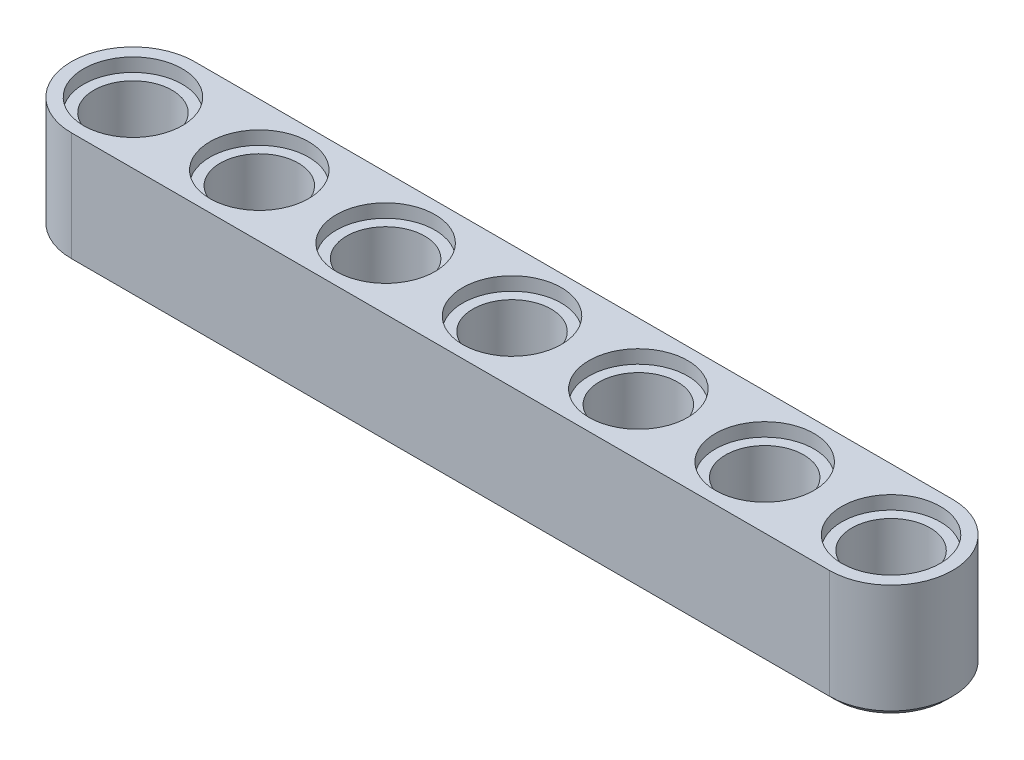
from build123d import *

# Parameters (mm, degrees)
BOSS_EXTRUDE1_DEPTH       = 7.3
SKETCH2_R                 = 2.475
CUT_EXTRUDE1_DEPTH        = 53.555779891
SKETCH3_R                 = 3.125
CUT_EXTRUDE2_DEPTH        = 0.85
LPATTERN1_COUNT           = 7
LPATTERN1_PITCH           = 8
LPATTERN1_COPY_1_SKETCH_R = 3.125
LPATTERN1_COPY_1_DEPTH    = 0.85
LPATTERN1_COPY_2_SKETCH_R = 3.125
LPATTERN1_COPY_2_DEPTH    = 0.85
LPATTERN1_COPY_3_SKETCH_R = 3.125
LPATTERN1_COPY_3_DEPTH    = 0.85
LPATTERN1_COPY_4_SKETCH_R = 3.125
LPATTERN1_COPY_4_DEPTH    = 0.85
LPATTERN1_COPY_5_SKETCH_R = 3.125
LPATTERN1_COPY_5_DEPTH    = 0.85
LPATTERN1_COPY_6_SKETCH_R = 3.125
LPATTERN1_COPY_6_DEPTH    = 0.85
CHAMFER1_SIZE             = 0.4


with BuildPart() as part:
    # Sketch1 → Boss-Extrude1 (new body)
    with BuildSketch(Plane(origin=(0, 0, 0), x_dir=(1, 0, 0), z_dir=(0, 1, 0))):
        with BuildLine():
            Line((0, 3.9), (48, 3.9))
            ThreePointArc((48, 3.9), (51.9, 0), (48, -3.9))
            Line((48, -3.9), (0, -3.9))
            ThreePointArc((0, -3.9), (-3.9, 0), (0, 3.9))
        make_face()
    extrude(amount=BOSS_EXTRUDE1_DEPTH)

    # Sketch2 → Cut-Extrude1 (cut, through all)
    with BuildSketch(Plane(origin=(0, 7.3, 0), x_dir=(1, 0, 0), z_dir=(0, 1, 0))):
        with Locations(Location((0, 0, 0), (0, 0, 270))):
            Circle(SKETCH2_R)
    cut_extrude1 = extrude(amount=-CUT_EXTRUDE1_DEPTH, mode=Mode.SUBTRACT)

    # Sketch3 → Cut-Extrude2 (cut)
    with BuildSketch(Plane(origin=(0, 7.3, 0), x_dir=(1, 0, 0), z_dir=(0, 1, 0))):
        with Locations(Location((0, 0, 0), (0, 0, 270))):
            Circle(SKETCH3_R)
    cut_extrude2 = extrude(amount=-CUT_EXTRUDE2_DEPTH, mode=Mode.SUBTRACT)

    # Mirror1: Cut-Extrude2 across plane
    add(cut_extrude2.mirror(Plane.ZX.offset(3.65)), mode=Mode.SUBTRACT)

    # LPattern1: Cut-Extrude1, Cut-Extrude2 ×7
    with Locations(*[(i * LPATTERN1_PITCH, 0, 0) for i in range(1, LPATTERN1_COUNT)]):
        add(cut_extrude1, mode=Mode.SUBTRACT)
        add(cut_extrude2, mode=Mode.SUBTRACT)

    # LPattern1 copy 1 sketch → LPattern1 copy 1 (cut)
    with BuildSketch(Plane(origin=(8, 0, 0), x_dir=(1, 0, 0), z_dir=(0, -1, 0))):
        Circle(LPATTERN1_COPY_1_SKETCH_R)
    extrude(amount=-LPATTERN1_COPY_1_DEPTH, mode=Mode.SUBTRACT)

    # LPattern1 copy 2 sketch → LPattern1 copy 2 (cut)
    with BuildSketch(Plane(origin=(16, 0, 0), x_dir=(1, 0, 0), z_dir=(0, -1, 0))):
        Circle(LPATTERN1_COPY_2_SKETCH_R)
    extrude(amount=-LPATTERN1_COPY_2_DEPTH, mode=Mode.SUBTRACT)

    # LPattern1 copy 3 sketch → LPattern1 copy 3 (cut)
    with BuildSketch(Plane(origin=(24, 0, 0), x_dir=(1, 0, 0), z_dir=(0, -1, 0))):
        Circle(LPATTERN1_COPY_3_SKETCH_R)
    extrude(amount=-LPATTERN1_COPY_3_DEPTH, mode=Mode.SUBTRACT)

    # LPattern1 copy 4 sketch → LPattern1 copy 4 (cut)
    with BuildSketch(Plane(origin=(32, 0, 0), x_dir=(1, 0, 0), z_dir=(0, -1, 0))):
        Circle(LPATTERN1_COPY_4_SKETCH_R)
    extrude(amount=-LPATTERN1_COPY_4_DEPTH, mode=Mode.SUBTRACT)

    # LPattern1 copy 5 sketch → LPattern1 copy 5 (cut)
    with BuildSketch(Plane(origin=(40, 0, 0), x_dir=(1, 0, 0), z_dir=(0, -1, 0))):
        Circle(LPATTERN1_COPY_5_SKETCH_R)
    extrude(amount=-LPATTERN1_COPY_5_DEPTH, mode=Mode.SUBTRACT)

    # LPattern1 copy 6 sketch → LPattern1 copy 6 (cut)
    with BuildSketch(Plane(origin=(48, 0, 0), x_dir=(1, 0, 0), z_dir=(0, -1, 0))):
        Circle(LPATTERN1_COPY_6_SKETCH_R)
    extrude(amount=-LPATTERN1_COPY_6_DEPTH, mode=Mode.SUBTRACT)

    # Chamfer1
    # the kernel refuses this chamfer: 0.4 mm, written as the material it takes off along each edge
    with BuildSketch(Plane(origin=(16, 0, 0), x_dir=(1, 0, 0), z_dir=(0, 0, -1))) as chamfer1_piece_1:
        Polygon((3.125 + CHAMFER1_SIZE, 0), (3.125, -CHAMFER1_SIZE), (3.125, 0), align=None)
    revolve(axis=Axis((16, 0, 0), (0, -1, 0)), mode=Mode.SUBTRACT)
    with BuildSketch(Plane(origin=(24, 0, 0), x_dir=(1, 0, 0), z_dir=(0, 0, -1))) as chamfer1_piece_2:
        Polygon((3.125 + CHAMFER1_SIZE, 0), (3.125, -CHAMFER1_SIZE), (3.125, 0), align=None)
    revolve(axis=Axis((24, 0, 0), (0, -1, 0)), mode=Mode.SUBTRACT)
    with BuildSketch(Plane(origin=(32, 0, 0), x_dir=(1, 0, 0), z_dir=(0, 0, -1))) as chamfer1_piece_3:
        Polygon((3.125 + CHAMFER1_SIZE, 0), (3.125, -CHAMFER1_SIZE), (3.125, 0), align=None)
    revolve(axis=Axis((32, 0, 0), (0, -1, 0)), mode=Mode.SUBTRACT)
    with BuildSketch(Plane(origin=(40, 0, 0), x_dir=(1, 0, 0), z_dir=(0, 0, -1))) as chamfer1_piece_4:
        Polygon((3.125 + CHAMFER1_SIZE, 0), (3.125, -CHAMFER1_SIZE), (3.125, 0), align=None)
    revolve(axis=Axis((40, 0, 0), (0, -1, 0)), mode=Mode.SUBTRACT)
    with BuildSketch(Plane(origin=(48, 0, 0), x_dir=(1, 0, 0), z_dir=(0, 0, -1))) as chamfer1_piece_5:
        Polygon((3.125 + CHAMFER1_SIZE, 0), (3.125, -CHAMFER1_SIZE), (3.125, 0), align=None)
    revolve(axis=Axis((48, 0, 0), (0, -1, 0)), mode=Mode.SUBTRACT)
    with BuildSketch(Plane(origin=(0, 0, 0), x_dir=(0, 0, 1), z_dir=(-1, 0, 0))) as chamfer1_piece_6:
        Polygon((3.125 + CHAMFER1_SIZE, 0), (3.125, CHAMFER1_SIZE), (3.125, 0), align=None)
    revolve(axis=Axis((0, 0, 0), (0, 1, 0)), mode=Mode.SUBTRACT)
    with BuildSketch(Plane(origin=(0, 0, -3.9), x_dir=(0, 0.9996219169112968, -0.027495876610586275), z_dir=(1, 0, 0))) as chamfer1_piece_7:
        Polygon((CHAMFER1_SIZE * 0.999621916911, CHAMFER1_SIZE * 0.0274958766106), (-CHAMFER1_SIZE * 0.0274958766106, CHAMFER1_SIZE * 0.999621916911), (0, 0), align=None)
    extrude(amount=48, mode=Mode.SUBTRACT)
    with BuildSketch(Plane(origin=(48, 0, 0), x_dir=(0, 0, -1), z_dir=(-1, 0, 0))) as chamfer1_piece_8:
        Polygon((3.9, -CHAMFER1_SIZE), (3.9 - CHAMFER1_SIZE, 0), (3.9, 0), align=None)
    revolve(axis=Axis((48, 0, 0), (0, -1, 0)), revolution_arc=180, mode=Mode.SUBTRACT)
    with BuildSketch(Plane(origin=(48, 0, 3.9), x_dir=(0, -0.027495876610586386, -0.9996219169112968), z_dir=(-1, 0, 0))) as chamfer1_piece_9:
        Polygon((CHAMFER1_SIZE * 0.999621916911, -CHAMFER1_SIZE * 0.0274958766106), (-CHAMFER1_SIZE * 0.0274958766106, -CHAMFER1_SIZE * 0.999621916911), (0, 0), align=None)
    extrude(amount=48, mode=Mode.SUBTRACT)
    with BuildSketch(Plane(origin=(0, 0, 0), x_dir=(0, 0, 1), z_dir=(1, 0, 0))) as chamfer1_piece_10:
        Polygon((3.9, -CHAMFER1_SIZE), (3.9 - CHAMFER1_SIZE, 0), (3.9, 0), align=None)
    revolve(axis=Axis((0, 0, 0), (0, -1, 0)), revolution_arc=180, mode=Mode.SUBTRACT)
    with BuildSketch(Plane(origin=(8, 0, 0), x_dir=(1, 0, 0), z_dir=(0, 0, -1))) as chamfer1_piece_11:
        Polygon((3.125 + CHAMFER1_SIZE, 0), (3.125, -CHAMFER1_SIZE), (3.125, 0), align=None)
    revolve(axis=Axis((8, 0, 0), (0, -1, 0)), mode=Mode.SUBTRACT)


solid = part.part
